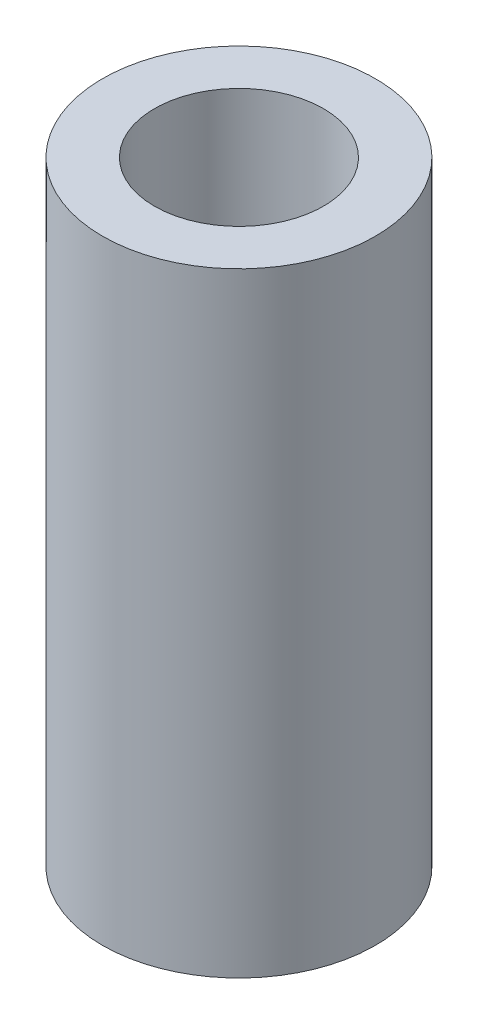
from build123d import *

# Parameters (mm, degrees)
SKETCH1_R           = 12.5
BOSS_EXTRUDE1_DEPTH = 56.260757245
SKETCH2_R           = 7.744100782
CUT_EXTRUDE1_DEPTH  = 59.972644554


with BuildPart() as part:
    # Sketch1 → Boss-Extrude1 (new body)
    with BuildSketch(Plane(origin=(0, 0, 0), x_dir=(1, 0, 0), z_dir=(0, 1, 0))):
        Circle(SKETCH1_R)
    extrude(amount=BOSS_EXTRUDE1_DEPTH)

    # Sketch2 → Cut-Extrude1 (cut, through all)
    with BuildSketch(Plane(origin=(0, 0, 0), x_dir=(1, 0, 0), z_dir=(0, 1, 0))):
        Circle(SKETCH2_R)
    extrude(amount=CUT_EXTRUDE1_DEPTH, mode=Mode.SUBTRACT)


solid = part.part
